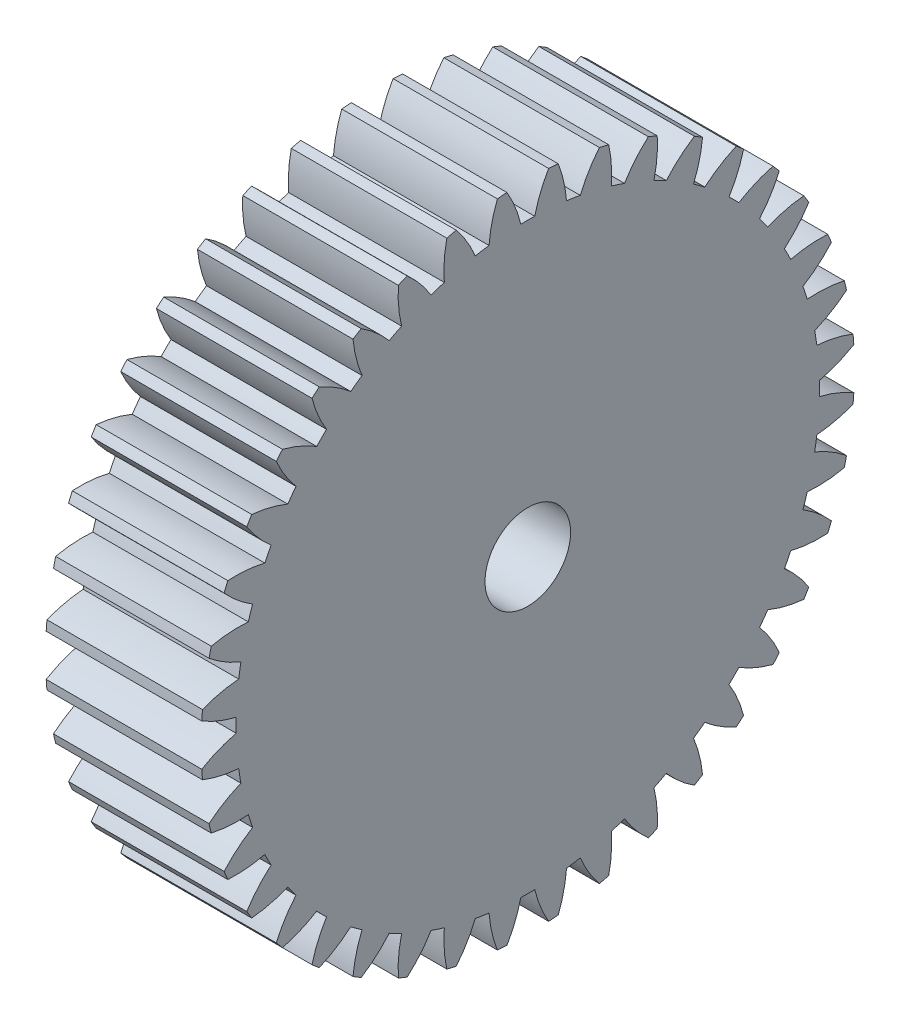
from build123d import *

# Parameters (mm, degrees)
SKETCH1_R           = 0.4
BOSS_EXTRUDE1_DEPTH = 4
SKETCH2_R           = 1.1
CUT_EXTRUDE1_DEPTH  = 23.809311719


with BuildPart() as part:
    # Sketch1 → Boss-Extrude1 (new body)
    with BuildSketch(Plane(origin=(-1.595003587, 0, 0), x_dir=(0, 0, -1), z_dir=(1, 0, 0))):
        with BuildLine():
            ThreePointArc((-16.421043875, 7.469942673), (-15.991410659, 7.258334451), (-15.535008147, 7.113215577))
            ThreePointArc((-15.535008147, 7.113215577), (-15.537144789, 6.93421615), (-15.535008147, 6.755216723))
            ThreePointArc((-15.535008147, 6.755216723), (-15.991410659, 6.610097848), (-16.421043875, 6.398489626))
            ThreePointArc((-16.421043875, 6.398489626), (-16.412250392, 6.275159746), (-16.401642569, 6.151972656))
            ThreePointArc((-16.401642569, 6.151972656), (-15.944196031, 6.010179126), (-15.470710998, 5.938243988))
            ThreePointArc((-15.470710998, 5.938243988), (-15.444819655, 5.761114096), (-15.414707639, 5.584652694))
            ThreePointArc((-15.414707639, 5.584652694), (-15.842789485, 5.369923391), (-16.234030385, 5.093710975))
            ThreePointArc((-16.234030385, 5.093710975), (-16.20605212, 4.973275093), (-16.176304191, 4.853264071))
            ThreePointArc((-16.176304191, 4.853264071), (-15.702308183, 4.784776658), (-15.223399402, 4.787796539))
            ThreePointArc((-15.223399402, 4.787796539), (-15.170117605, 4.616897709), (-15.112771672, 4.447319396))
            ThreePointArc((-15.112771672, 4.447319396), (-15.501992057, 4.168267012), (-15.845206991, 3.834251669))
            ThreePointArc((-15.845206991, 3.834251669), (-15.798732862, 3.719675318), (-15.750577319, 3.605795432))
            ThreePointArc((-15.750577319, 3.605795432), (-15.271703197, 3.612300524), (-14.799162991, 3.690201065))
            ThreePointArc((-14.799162991, 3.690201065), (-14.719802714, 3.529741392), (-14.636634912, 3.37122175))
            ThreePointArc((-14.636634912, 3.37122175), (-14.977409938, 3.034717482), (-15.264147815, 2.651123777))
            ThreePointArc((-15.264147815, 2.651123777), (-15.20032217, 2.545228206), (-15.134944762, 2.440283557))
            ThreePointArc((-15.134944762, 2.440283557), (-14.662983996, 2.521620978), (-14.208447873, 2.672484008))
            ThreePointArc((-14.208447873, 2.672484008), (-14.10496323, 2.526414543), (-13.998021427, 2.382856851))
            ThreePointArc((-13.998021427, 2.382856851), (-14.281960081, 1.99718655), (-14.505160462, 1.573459834))
            ThreePointArc((-14.505160462, 1.573459834), (-14.4255549, 1.478852544), (-14.344565436, 1.385427217))
            ThreePointArc((-14.344565436, 1.385427217), (-13.891139267, 1.53959417), (-13.465799416, 1.75970494))
            ThreePointArc((-13.465799416, 1.75970494), (-13.340738541, 1.631622397), (-13.212655998, 1.506561523))
            ThreePointArc((-13.212655998, 1.506561523), (-13.432766769, 1.081221672), (-13.586933722, 0.627795502))
            ThreePointArc((-13.586933722, 0.627795502), (-13.493508395, 0.546806039), (-13.398901105, 0.467200476))
            ThreePointArc((-13.398901105, 0.467200476), (-12.975174389, 0.690400858), (-12.589504088, 0.974339512))
            ThreePointArc((-12.589504088, 0.974339512), (-12.445946396, 0.867397709), (-12.299876931, 0.763913065))
            ThreePointArc((-12.299876931, 0.763913065), (-12.45073996, 0.309376943), (-12.532077382, -0.162583823))
            ThreePointArc((-12.532077382, -0.162583823), (-12.427132733, -0.227961231), (-12.321237162, -0.291786876))
            ThreePointArc((-12.321237162, -0.291786876), (-11.937643457, -0.005048999), (-11.601139189, 0.335726026))
            ThreePointArc((-11.601139189, 0.335726026), (-11.442619547, 0.252558225), (-11.282159874, 0.173197948))
            ThreePointArc((-11.282159874, 0.173197948), (-11.360060414, -0.299342258), (-11.366565507, -0.77821638))
            ThreePointArc((-11.366565507, -0.77821638), (-11.252685621, -0.826371923), (-11.13810927, -0.872846052))
            ThreePointArc((-11.13810927, -0.872846052), (-10.804093926, -0.529631118), (-10.525041542, -0.140410734))
            ThreePointArc((-10.525041542, -0.140410734), (-10.35546323, -0.197756666), (-10.1845644, -0.251038463))
            ThreePointArc((-10.1845644, -0.251038463), (-10.187584281, -0.729947245), (-10.119096868, -1.203943252))
            ThreePointArc((-10.119096868, -1.203943252), (-9.999085845, -1.233691182), (-9.878649964, -1.261669446))
            ThreePointArc((-9.878649964, -1.261669446), (-9.602437548, -0.870428546), (-9.387708245, -0.4423467))
            ThreePointArc((-9.387708245, -0.4423467), (-9.211246842, -0.472458717), (-9.034116951, -0.498350059))
            ThreePointArc((-9.034116951, -0.498350059), (-8.962181813, -0.971835092), (-8.820388282, -1.42928163))
            ThreePointArc((-8.820388282, -1.42928163), (-8.697201193, -1.439889454), (-8.573871312, -1.448682937))
            ThreePointArc((-8.573871312, -1.448682937), (-8.362263091, -1.01904972), (-8.217144216, -0.562647208))
            ThreePointArc((-8.217144216, -0.562647208), (-8.038144789, -0.56478385), (-7.859145362, -0.562647208))
            ThreePointArc((-7.859145362, -0.562647208), (-7.714026487, -1.01904972), (-7.502418266, -1.448682937))
            ThreePointArc((-7.502418266, -1.448682937), (-7.379088385, -1.439889454), (-7.255901296, -1.42928163))
            ThreePointArc((-7.255901296, -1.42928163), (-7.114107765, -0.971835092), (-7.042172627, -0.498350059))
            ThreePointArc((-7.042172627, -0.498350059), (-6.865042736, -0.472458717), (-6.688581333, -0.4423467))
            ThreePointArc((-6.688581333, -0.4423467), (-6.47385203, -0.870428546), (-6.197639614, -1.261669446))
            ThreePointArc((-6.197639614, -1.261669446), (-6.077203733, -1.233691182), (-5.95719271, -1.203943252))
            ThreePointArc((-5.95719271, -1.203943252), (-5.888705297, -0.729947245), (-5.891725178, -0.251038463))
            ThreePointArc((-5.891725178, -0.251038463), (-5.720826348, -0.197756666), (-5.551248036, -0.140410734))
            ThreePointArc((-5.551248036, -0.140410734), (-5.272195652, -0.529631118), (-4.938180308, -0.872846052))
            ThreePointArc((-4.938180308, -0.872846052), (-4.823603957, -0.826371923), (-4.709724071, -0.77821638))
            ThreePointArc((-4.709724071, -0.77821638), (-4.716229164, -0.299342258), (-4.794129704, 0.173197948))
            ThreePointArc((-4.794129704, 0.173197948), (-4.633670031, 0.252558225), (-4.47515039, 0.335726026))
            ThreePointArc((-4.47515039, 0.335726026), (-4.138646121, -0.005048999), (-3.755052416, -0.291786876))
            ThreePointArc((-3.755052416, -0.291786876), (-3.649156845, -0.227961231), (-3.544212196, -0.162583823))
            ThreePointArc((-3.544212196, -0.162583823), (-3.625549618, 0.309376943), (-3.776412647, 0.763913065))
            ThreePointArc((-3.776412647, 0.763913065), (-3.630343182, 0.867397709), (-3.486785491, 0.974339512))
            ThreePointArc((-3.486785491, 0.974339512), (-3.101115189, 0.690400858), (-2.677388473, 0.467200476))
            ThreePointArc((-2.677388473, 0.467200476), (-2.582781183, 0.546806039), (-2.489355857, 0.627795502))
            ThreePointArc((-2.489355857, 0.627795502), (-2.643522809, 1.081221672), (-2.86363358, 1.506561523))
            ThreePointArc((-2.86363358, 1.506561523), (-2.735551037, 1.631622397), (-2.610490163, 1.75970494))
            ThreePointArc((-2.610490163, 1.75970494), (-2.185150311, 1.53959417), (-1.731724142, 1.385427217))
            ThreePointArc((-1.731724142, 1.385427217), (-1.650734678, 1.478852544), (-1.571129116, 1.573459834))
            ThreePointArc((-1.571129116, 1.573459834), (-1.794329498, 1.99718655), (-2.078268151, 2.382856851))
            ThreePointArc((-2.078268151, 2.382856851), (-1.971326348, 2.526414543), (-1.867841705, 2.672484008))
            ThreePointArc((-1.867841705, 2.672484008), (-1.413305582, 2.521620978), (-0.941344816, 2.440283557))
            ThreePointArc((-0.941344816, 2.440283557), (-0.875967408, 2.545228206), (-0.812141763, 2.651123777))
            ThreePointArc((-0.812141763, 2.651123777), (-1.09887964, 3.034717482), (-1.439654666, 3.37122175))
            ThreePointArc((-1.439654666, 3.37122175), (-1.356486864, 3.529741392), (-1.277126587, 3.690201065))
            ThreePointArc((-1.277126587, 3.690201065), (-0.804586381, 3.612300524), (-0.325712259, 3.605795432))
            ThreePointArc((-0.325712259, 3.605795432), (-0.277556716, 3.719675318), (-0.231082588, 3.834251669))
            ThreePointArc((-0.231082588, 3.834251669), (-0.574297521, 4.168267012), (-0.963517906, 4.447319396))
            ThreePointArc((-0.963517906, 4.447319396), (-0.906171973, 4.616897709), (-0.852890176, 4.787796539))
            ThreePointArc((-0.852890176, 4.787796539), (-0.373981395, 4.784776658), (0.100014613, 4.853264071))
            ThreePointArc((0.100014613, 4.853264071), (0.129762542, 4.973275093), (0.157740807, 5.093710975))
            ThreePointArc((0.157740807, 5.093710975), (-0.233500093, 5.369923391), (-0.661581939, 5.584652694))
            ThreePointArc((-0.661581939, 5.584652694), (-0.631469923, 5.761114096), (-0.60557858, 5.938243988))
            ThreePointArc((-0.60557858, 5.938243988), (-0.132093547, 6.010179126), (0.325352991, 6.151972656))
            ThreePointArc((0.325352991, 6.151972656), (0.335960814, 6.275159746), (0.344754297, 6.398489626))
            ThreePointArc((0.344754297, 6.398489626), (-0.08487892, 6.610097848), (-0.541281431, 6.755216723))
            ThreePointArc((-0.541281431, 6.755216723), (-0.539144789, 6.93421615), (-0.541281431, 7.113215577))
            ThreePointArc((-0.541281431, 7.113215577), (-0.08487892, 7.258334451), (0.344754297, 7.469942673))
            ThreePointArc((0.344754297, 7.469942673), (0.335960814, 7.593272554), (0.325352991, 7.716459643))
            ThreePointArc((0.325352991, 7.716459643), (-0.132093547, 7.858253174), (-0.60557858, 7.930188312))
            ThreePointArc((-0.60557858, 7.930188312), (-0.631469923, 8.107318203), (-0.661581939, 8.283779605))
            ThreePointArc((-0.661581939, 8.283779605), (-0.233500093, 8.498508909), (0.157740807, 8.774721324))
            ThreePointArc((0.157740807, 8.774721324), (0.129762542, 8.895157206), (0.100014613, 9.015168229))
            ThreePointArc((0.100014613, 9.015168229), (-0.373981395, 9.083655641), (-0.852890176, 9.08063576))
            ThreePointArc((-0.852890176, 9.08063576), (-0.906171973, 9.25153459), (-0.963517906, 9.421112903))
            ThreePointArc((-0.963517906, 9.421112903), (-0.574297521, 9.700165287), (-0.231082588, 10.03418063))
            ThreePointArc((-0.231082588, 10.03418063), (-0.277556716, 10.148756981), (-0.325712259, 10.262636868))
            ThreePointArc((-0.325712259, 10.262636868), (-0.804586381, 10.256131775), (-1.277126587, 10.178231235))
            ThreePointArc((-1.277126587, 10.178231235), (-1.356486864, 10.338690907), (-1.439654666, 10.497210549))
            ThreePointArc((-1.439654666, 10.497210549), (-1.09887964, 10.833714818), (-0.812141763, 11.217308522))
            ThreePointArc((-0.812141763, 11.217308522), (-0.875967408, 11.323204093), (-0.941344816, 11.428148742))
            ThreePointArc((-0.941344816, 11.428148742), (-1.413305582, 11.346811321), (-1.867841705, 11.195948291))
            ThreePointArc((-1.867841705, 11.195948291), (-1.971326348, 11.342017757), (-2.078268151, 11.485575448))
            ThreePointArc((-2.078268151, 11.485575448), (-1.794329498, 11.871245749), (-1.571129116, 12.294972466))
            ThreePointArc((-1.571129116, 12.294972466), (-1.650734678, 12.389579756), (-1.731724142, 12.483005082))
            ThreePointArc((-1.731724142, 12.483005082), (-2.185150311, 12.32883813), (-2.610490163, 12.108727359))
            ThreePointArc((-2.610490163, 12.108727359), (-2.735551037, 12.236809902), (-2.86363358, 12.361870776))
            ThreePointArc((-2.86363358, 12.361870776), (-2.643522809, 12.787210628), (-2.489355857, 13.240636797))
            ThreePointArc((-2.489355857, 13.240636797), (-2.582781183, 13.321626261), (-2.677388473, 13.401231823))
            ThreePointArc((-2.677388473, 13.401231823), (-3.101115189, 13.178031441), (-3.486785491, 12.894092787))
            ThreePointArc((-3.486785491, 12.894092787), (-3.630343182, 13.00103459), (-3.776412647, 13.104519234))
            ThreePointArc((-3.776412647, 13.104519234), (-3.625549618, 13.559055357), (-3.544212196, 14.031016122))
            ThreePointArc((-3.544212196, 14.031016122), (-3.649156845, 14.09639353), (-3.755052416, 14.160219175))
            ThreePointArc((-3.755052416, 14.160219175), (-4.138646121, 13.873481298), (-4.47515039, 13.532706273))
            ThreePointArc((-4.47515039, 13.532706273), (-4.633670031, 13.615874075), (-4.794129704, 13.695234352))
            ThreePointArc((-4.794129704, 13.695234352), (-4.716229164, 14.167774558), (-4.709724071, 14.646648679))
            ThreePointArc((-4.709724071, 14.646648679), (-4.823603957, 14.694804223), (-4.938180308, 14.741278351))
            ThreePointArc((-4.938180308, 14.741278351), (-5.272195652, 14.398063417), (-5.551248036, 14.008843033))
            ThreePointArc((-5.551248036, 14.008843033), (-5.720826348, 14.066188965), (-5.891725178, 14.119470763))
            ThreePointArc((-5.891725178, 14.119470763), (-5.888705297, 14.598379544), (-5.95719271, 15.072375551))
            ThreePointArc((-5.95719271, 15.072375551), (-6.077203733, 15.102123481), (-6.197639614, 15.130101746))
            ThreePointArc((-6.197639614, 15.130101746), (-6.47385203, 14.738860845), (-6.688581333, 14.310779))
            ThreePointArc((-6.688581333, 14.310779), (-6.865042736, 14.340891016), (-7.042172627, 14.366782359))
            ThreePointArc((-7.042172627, 14.366782359), (-7.114107765, 14.840267392), (-7.255901296, 15.29771393))
            ThreePointArc((-7.255901296, 15.29771393), (-7.379088385, 15.308321753), (-7.502418266, 15.317115236))
            ThreePointArc((-7.502418266, 15.317115236), (-7.714026487, 14.887482019), (-7.859145362, 14.431079507))
            ThreePointArc((-7.859145362, 14.431079507), (-8.038144789, 14.43321615), (-8.217144216, 14.431079507))
            ThreePointArc((-8.217144216, 14.431079507), (-8.362263091, 14.887482019), (-8.573871312, 15.317115236))
            ThreePointArc((-8.573871312, 15.317115236), (-8.697201193, 15.308321753), (-8.820388282, 15.29771393))
            ThreePointArc((-8.820388282, 15.29771393), (-8.962181813, 14.840267392), (-9.034116951, 14.366782359))
            ThreePointArc((-9.034116951, 14.366782359), (-9.211246842, 14.340891016), (-9.387708245, 14.310779))
            ThreePointArc((-9.387708245, 14.310779), (-9.602437548, 14.738860845), (-9.878649964, 15.130101746))
            ThreePointArc((-9.878649964, 15.130101746), (-9.999085845, 15.102123481), (-10.119096868, 15.072375551))
            ThreePointArc((-10.119096868, 15.072375551), (-10.187584281, 14.598379544), (-10.1845644, 14.119470763))
            ThreePointArc((-10.1845644, 14.119470763), (-10.35546323, 14.066188965), (-10.525041542, 14.008843033))
            ThreePointArc((-10.525041542, 14.008843033), (-10.804093926, 14.398063417), (-11.13810927, 14.741278351))
            ThreePointArc((-11.13810927, 14.741278351), (-11.252685621, 14.694804223), (-11.366565507, 14.646648679))
            ThreePointArc((-11.366565507, 14.646648679), (-11.360060414, 14.167774558), (-11.282159874, 13.695234352))
            ThreePointArc((-11.282159874, 13.695234352), (-11.442619547, 13.615874075), (-11.601139189, 13.532706273))
            ThreePointArc((-11.601139189, 13.532706273), (-11.937643457, 13.873481298), (-12.321237162, 14.160219175))
            ThreePointArc((-12.321237162, 14.160219175), (-12.427132733, 14.09639353), (-12.532077382, 14.031016122))
            ThreePointArc((-12.532077382, 14.031016122), (-12.45073996, 13.559055357), (-12.299876931, 13.104519234))
            ThreePointArc((-12.299876931, 13.104519234), (-12.445946396, 13.00103459), (-12.589504088, 12.894092787))
            ThreePointArc((-12.589504088, 12.894092787), (-12.975174389, 13.178031441), (-13.398901105, 13.401231823))
            ThreePointArc((-13.398901105, 13.401231823), (-13.493508395, 13.321626261), (-13.586933722, 13.240636797))
            ThreePointArc((-13.586933722, 13.240636797), (-13.432766769, 12.787210628), (-13.212655998, 12.361870776))
            ThreePointArc((-13.212655998, 12.361870776), (-13.340738541, 12.236809902), (-13.465799416, 12.108727359))
            ThreePointArc((-13.465799416, 12.108727359), (-13.891139267, 12.32883813), (-14.344565436, 12.483005082))
            ThreePointArc((-14.344565436, 12.483005082), (-14.4255549, 12.389579756), (-14.505160462, 12.294972466))
            ThreePointArc((-14.505160462, 12.294972466), (-14.281960081, 11.871245749), (-13.998021427, 11.485575448))
            ThreePointArc((-13.998021427, 11.485575448), (-14.10496323, 11.342017757), (-14.208447873, 11.195948291))
            ThreePointArc((-14.208447873, 11.195948291), (-14.662983996, 11.346811321), (-15.134944762, 11.428148742))
            ThreePointArc((-15.134944762, 11.428148742), (-15.20032217, 11.323204093), (-15.264147815, 11.217308522))
            ThreePointArc((-15.264147815, 11.217308522), (-14.977409938, 10.833714818), (-14.636634912, 10.497210549))
            ThreePointArc((-14.636634912, 10.497210549), (-14.719802714, 10.338690907), (-14.799162991, 10.178231235))
            ThreePointArc((-14.799162991, 10.178231235), (-15.271703197, 10.256131775), (-15.750577319, 10.262636868))
            ThreePointArc((-15.750577319, 10.262636868), (-15.798732862, 10.148756981), (-15.845206991, 10.03418063))
            ThreePointArc((-15.845206991, 10.03418063), (-15.501992057, 9.700165287), (-15.112771672, 9.421112903))
            ThreePointArc((-15.112771672, 9.421112903), (-15.170117605, 9.25153459), (-15.223399402, 9.08063576))
            ThreePointArc((-15.223399402, 9.08063576), (-15.702308183, 9.083655641), (-16.176304191, 9.015168229))
            ThreePointArc((-16.176304191, 9.015168229), (-16.20605212, 8.895157206), (-16.234030385, 8.774721324))
            ThreePointArc((-16.234030385, 8.774721324), (-15.842789485, 8.498508909), (-15.414707639, 8.283779605))
            ThreePointArc((-15.414707639, 8.283779605), (-15.444819655, 8.107318203), (-15.470710998, 7.930188312))
            ThreePointArc((-15.470710998, 7.930188312), (-15.944196031, 7.858253174), (-16.401642569, 7.716459643))
            ThreePointArc((-16.401642569, 7.716459643), (-16.412250392, 7.593272554), (-16.421043875, 7.469942673))
        make_face()
        with Locations((-8.038144789, 6.93421615)):
            Circle(SKETCH1_R, mode=Mode.SUBTRACT)
    extrude(amount=-BOSS_EXTRUDE1_DEPTH)

    # Sketch2 → Cut-Extrude1 (cut, through all)
    with BuildSketch(Plane(origin=(-1.595003587, 0, 0), x_dir=(0, 0, -1), z_dir=(1, 0, 0))):
        with Locations((-8.038144789, 6.93421615)):
            Circle(SKETCH2_R)
    extrude(amount=-CUT_EXTRUDE1_DEPTH, mode=Mode.SUBTRACT)


solid = part.part
